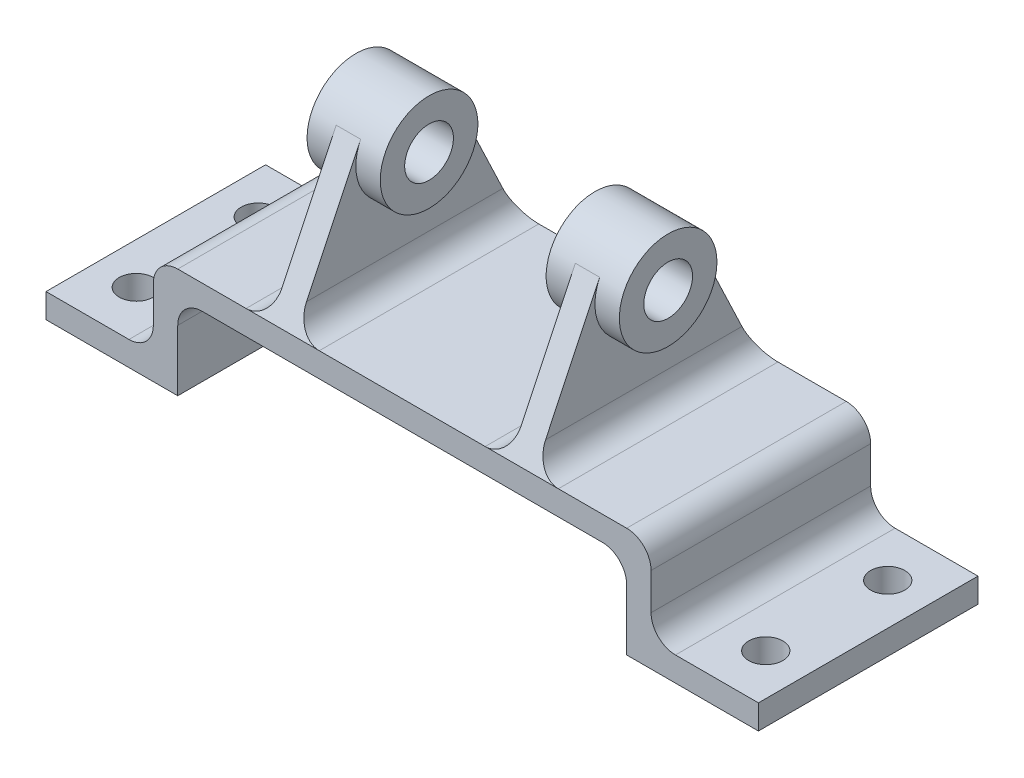
from build123d import *

# Parameters (mm, degrees)
BOSS_EXTRUDE1_DEPTH      = 90
FILLET1_R                = 10
SKETCH2_R                = 7
CUT_EXTRUDE1_DEPTH       = 10
SKETCH10_R               = 20
SKETCH10_R_2             = 10
BOSS_EXTRUDE5_DEPTH      = 68
SKETCH11_R               = 20
SKETCH11_R_2             = 10
CUT_EXTRUDE5_DEPTH       = 38
BOSS_EXTRUDE6_DEPTH      = 5
BOSS_EXTRUDE6_DEPTH_BACK = 5
FILLET3_R                = 10
SKETCH15_R               = 20
SKETCH15_R_2             = 10
BOSS_EXTRUDE7_DEPTH      = 68
CUT_EXTRUDE6_START       = -38
SKETCH16_R               = 20
SKETCH16_R_2             = 10
CUT_EXTRUDE6_DEPTH       = 38
BOSS_EXTRUDE8_DEPTH      = 5
BOSS_EXTRUDE8_DEPTH_BACK = 5
FILLET4_R                = 10


with BuildPart() as part:
    # Sketch1 → Boss-Extrude1 (new body)
    with BuildSketch(Plane.XY):
        Polygon((-102, 10), (102, 10), (102, -25), (146, -25), (146, -35), (92, -35), (92, 0), (-92, 0), (-92, -35), (-146, -35), (-146, -25), (-102, -25), align=None)
    extrude(amount=-BOSS_EXTRUDE1_DEPTH)

    # Fillet1
    fillet1_edges = [part.edges().sort_by_distance(p)[0] for p in [
        (-102, -25, -45),
        (-102, 10, -45),
        (102, 10, -45),
        (102, -25, -45),
    ]]
    fillet(fillet1_edges, radius=FILLET1_R)

    # Sketch2 → Cut-Extrude1 (cut)
    with BuildSketch(Plane(origin=(0, -25, 0), x_dir=(1, 0, 0), z_dir=(0, 1, 0))):
        with Locations(Location((129, 20, 0), (0, 0, 270))):
            Circle(SKETCH2_R)
        with Locations(Location((129, 70, 0), (0, 0, 270))):
            Circle(SKETCH2_R)
        with Locations(Location((-129, 70, 0), (0, 0, 90))):
            Circle(SKETCH2_R)
        with Locations(Location((-129, 20, 0), (0, 0, 90))):
            Circle(SKETCH2_R)
    extrude(amount=-CUT_EXTRUDE1_DEPTH, mode=Mode.SUBTRACT)



with BuildPart() as body_2:
    # Sketch10 → Boss-Extrude5 (new body)
    with BuildSketch(Plane.ZY.offset(102)):
        with Locations((-45, 48)):
            Circle(SKETCH10_R)
        with Locations((-45, 48)):
            Circle(SKETCH10_R_2, mode=Mode.SUBTRACT)
    extrude(amount=-BOSS_EXTRUDE5_DEPTH)

    # Sketch11 → Cut-Extrude5 (cut)
    with BuildSketch(Plane.ZY.offset(102)):
        with Locations((-45, 48)):
            Circle(SKETCH11_R)
        with Locations((-45, 48)):
            Circle(SKETCH11_R_2, mode=Mode.SUBTRACT)
    extrude(amount=-CUT_EXTRUDE5_DEPTH, mode=Mode.SUBTRACT)


with BuildPart() as body_2_1:
    # Body-Move/Copy1: moved
    add(body_2.part.moved(Location((0, 10, 0))))


with BuildPart() as part_1:
    add(part.part)

    add(body_2_1.part)  # Boss-Extrude6 merges body 2
    # Sketch14 → Boss-Extrude6 (add, two sides: drawn at the far end of the back side and taken through both)
    with BuildSketch(Plane(origin=(-49, 0, 0), x_dir=(0, 0, -1), z_dir=(1, 0, 0)).offset(-BOSS_EXTRUDE6_DEPTH_BACK)):
        with BuildLine():
            Line((45, 10), (0, 10))
            Line((0, 10), (26.941680216, 66.596341464))
            ThreePointArc((26.941680216, 66.596341464), (45, 38), (63.058319784, 66.596341464))
            Line((63.058319784, 66.596341464), (90, 10))
            Line((90, 10), (45, 10))
        make_face()
    extrude(amount=BOSS_EXTRUDE6_DEPTH + BOSS_EXTRUDE6_DEPTH_BACK)

    # Fillet3
    # the kernel refuses this fillet: 10 mm, written as the material it adds along each edge
    with BuildSketch(Plane(origin=(-54, 10, 0), x_dir=(-1, 0, 0), z_dir=(0, 0, -1))) as fillet3_piece_1_section:
        with BuildLine():
            CenterArc((FILLET3_R, FILLET3_R), FILLET3_R, 180, 90)
            Line((0, FILLET3_R), (0, 0))
            Line((0, 0), (FILLET3_R, 0))
        make_face()
    fillet3_piece_1 = extrude(amount=90, mode=Mode.PRIVATE)
    fillet3_piece_1 = split(fillet3_piece_1, bisect_by=Plane(origin=(-56.293482883, 29.268794576, -9.172566427), z_dir=(0, -0.4298170732175253, -0.9029159892098049)), keep=Keep.TOP, mode=Mode.PRIVATE)
    fillet3_piece_1 = split(fillet3_piece_1, bisect_by=Plane(origin=(-56.293482883, 29.268794576, -80.827433573), z_dir=(0, -0.4298170732175253, 0.9029159892098049)), keep=Keep.TOP, mode=Mode.PRIVATE)
    add(fillet3_piece_1)
    with BuildSketch(Plane(origin=(-44, 10, -90), x_dir=(1, 0, 0), z_dir=(0, 0, 1))) as fillet3_piece_2_section:
        with BuildLine():
            CenterArc((FILLET3_R, FILLET3_R), FILLET3_R, 180, 90)
            Line((0, FILLET3_R), (0, 0))
            Line((0, 0), (FILLET3_R, 0))
        make_face()
    fillet3_piece_2 = extrude(amount=90, mode=Mode.PRIVATE)
    fillet3_piece_2 = split(fillet3_piece_2, bisect_by=Plane(origin=(-41.706517117, 29.268794576, -9.172566427), z_dir=(0, -0.4298170732175253, -0.9029159892098049)), keep=Keep.TOP, mode=Mode.PRIVATE)
    fillet3_piece_2 = split(fillet3_piece_2, bisect_by=Plane(origin=(-41.706517117, 29.268794576, -80.827433573), z_dir=(0, -0.4298170732175253, 0.9029159892098049)), keep=Keep.TOP, mode=Mode.PRIVATE)
    add(fillet3_piece_2)



with BuildPart() as body_2_2:
    # Sketch15 → Boss-Extrude7 (new body)
    with BuildSketch(Plane(origin=(102, 0, 0), x_dir=(0, 0, -1), z_dir=(1, 0, 0))):
        with Locations(Location((45, 58, 0), (0, 0, 180))):
            Circle(SKETCH15_R)
        with Locations(Location((45, 58, 0), (0, 0, 180))):
            Circle(SKETCH15_R_2, mode=Mode.SUBTRACT)
    extrude(amount=-BOSS_EXTRUDE7_DEPTH)

    # Sketch16 → Cut-Extrude6 (cut)
    with BuildSketch(Plane(origin=(102, 0, 0), x_dir=(0, 0, -1), z_dir=(1, 0, 0)).offset(CUT_EXTRUDE6_START)):
        with Locations(Location((45, 58, 0), (0, 0, 180))):
            Circle(SKETCH16_R)
        with Locations(Location((45, 58, 0), (0, 0, 180))):
            Circle(SKETCH16_R_2, mode=Mode.SUBTRACT)
    extrude(amount=CUT_EXTRUDE6_DEPTH, mode=Mode.SUBTRACT)


with BuildPart() as part_2:
    add(part_1.part)

    add(body_2_2.part)  # Boss-Extrude8 merges body 2 2
    # Sketch17 → Boss-Extrude8 (add, two sides: drawn at the far end of the back side and taken through both)
    with BuildSketch(Plane(origin=(49, 0, 0), x_dir=(0, 0, -1), z_dir=(1, 0, 0)).offset(-BOSS_EXTRUDE8_DEPTH_BACK)):
        with BuildLine():
            Line((45, 10), (0, 10))
            Line((0, 10), (26.941680216, 66.596341464))
            ThreePointArc((26.941680216, 66.596341464), (45, 38), (63.058319784, 66.596341464))
            Line((63.058319784, 66.596341464), (90, 10))
            Line((90, 10), (45, 10))
        make_face()
    extrude(amount=BOSS_EXTRUDE8_DEPTH + BOSS_EXTRUDE8_DEPTH_BACK)

    # Fillet4
    # the kernel refuses this fillet: 10 mm, written as the material it adds along each edge
    with BuildSketch(Plane(origin=(44, 10, 0), x_dir=(-1, 0, 0), z_dir=(0, 0, -1))) as fillet4_piece_1_section:
        with BuildLine():
            CenterArc((FILLET4_R, FILLET4_R), FILLET4_R, 180, 90)
            Line((0, FILLET4_R), (0, 0))
            Line((0, 0), (FILLET4_R, 0))
        make_face()
    fillet4_piece_1 = extrude(amount=90, mode=Mode.PRIVATE)
    fillet4_piece_1 = split(fillet4_piece_1, bisect_by=Plane(origin=(41.706517117, 29.268794576, -80.827433573), z_dir=(0, -0.4298170732175253, 0.9029159892098049)), keep=Keep.TOP, mode=Mode.PRIVATE)
    fillet4_piece_1 = split(fillet4_piece_1, bisect_by=Plane(origin=(41.706517117, 29.268794576, -9.172566427), z_dir=(0, -0.4298170732175254, -0.9029159892098049)), keep=Keep.TOP, mode=Mode.PRIVATE)
    add(fillet4_piece_1)
    with BuildSketch(Plane(origin=(54, 10, -90), x_dir=(1, 0, 0), z_dir=(0, 0, 1))) as fillet4_piece_2_section:
        with BuildLine():
            CenterArc((FILLET4_R, FILLET4_R), FILLET4_R, 180, 90)
            Line((0, FILLET4_R), (0, 0))
            Line((0, 0), (FILLET4_R, 0))
        make_face()
    fillet4_piece_2 = extrude(amount=90, mode=Mode.PRIVATE)
    fillet4_piece_2 = split(fillet4_piece_2, bisect_by=Plane(origin=(56.293482883, 29.268794576, -9.172566427), z_dir=(0, -0.4298170732175254, -0.9029159892098049)), keep=Keep.TOP, mode=Mode.PRIVATE)
    fillet4_piece_2 = split(fillet4_piece_2, bisect_by=Plane(origin=(56.293482883, 29.268794576, -80.827433573), z_dir=(0, -0.4298170732175253, 0.9029159892098049)), keep=Keep.TOP, mode=Mode.PRIVATE)
    add(fillet4_piece_2)
    with BuildSketch(Plane(origin=(92, 0, 0), x_dir=(0, -1, 0), z_dir=(0, 0, -1)), Plane(origin=(-92, 0, 0), x_dir=(1, 0, 0), z_dir=(0, 0, -1))) as fillet4_piece_3:
        with BuildLine():
            CenterArc((FILLET4_R, FILLET4_R), FILLET4_R, 180, 90)
            Line((0, FILLET4_R), (0, 0))
            Line((0, 0), (FILLET4_R, 0))
        make_face()
    extrude(amount=90)


solid = part_2.part
